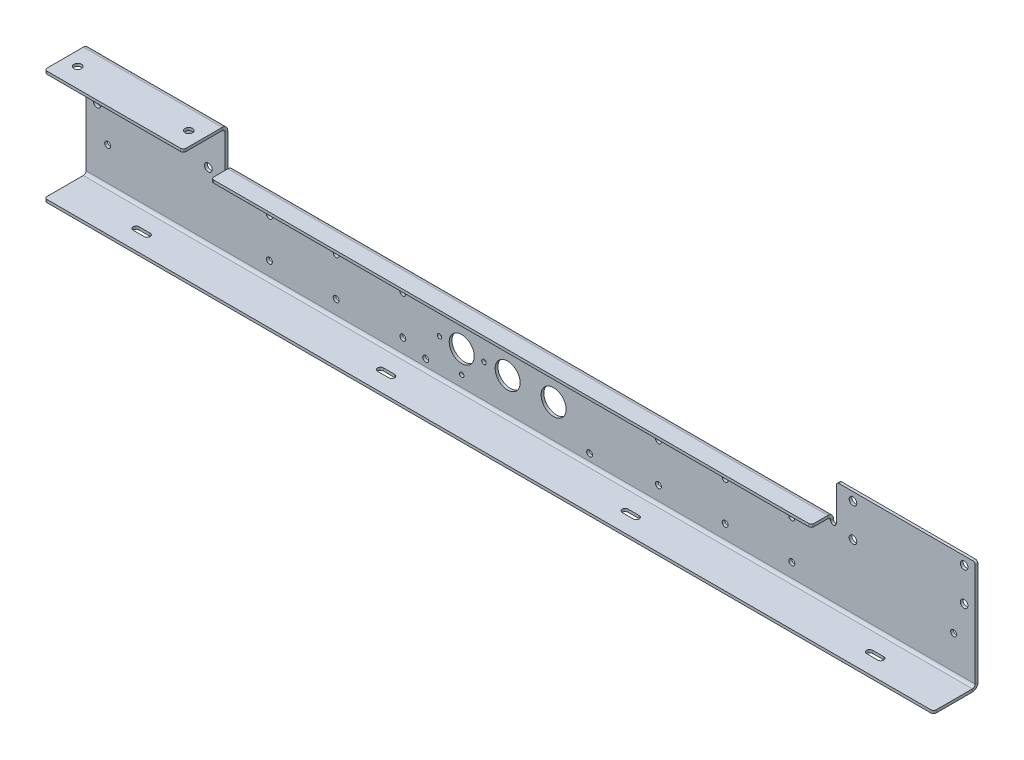
from build123d import *

# Parameters (mm, degrees)
SKETCH1_R                            = 3.37312
SKETCH1_R_2                          = 14.2875
SKETCH1_R_3                          = 3.3734375
SKETCH1_R_4                          = 2.5527
BASE_FLANGE1_DEPTH                   = 3.175
EDGE_FLANGE1_DEPTH                   = 1016
EDGE_FLANGE2_DEPTH                   = 685.8
EDGE_FLANGE3_STRIP_W                 = 19.05
EDGE_FLANGE3_STRIP_H                 = 3.175
EDGE_FLANGE3_STRIP_CUT_DEPTH         = 158.75
EDGE_FLANGE3_DEPTH                   = 158.75
FILLET1_R                            = 3.175
F_17_64_0_26563_DIAMETER_HOLE1_D     = 6.747002
F_11_32_0_34375_DIAMETER_HOLE1_D     = 8.73125
F_11_32_0_34375_DIAMETER_HOLE2_D     = 8.73125
F_11_32_0_34375_DIAMETER_HOLE2_DEPTH = 3.175
CUT_EXTRUDE2_DEPTH                   = 552.199750341


# Sheet-metal steps are written as plain solids
with BuildPart() as part:
    # Sketch1 → Base-Flange1 (new body)
    with BuildSketch(Plane.XY):
        with BuildLine():
            Line((-481.7491, 38.1), (-481.7491, 82.55))
            Line((-481.7491, 82.55), (-322.9991, 82.55))
            Line((-322.9991, 82.55), (-322.9991, 41.275))
            ThreePointArc((-322.9991, 41.275), (-322.06916403, 39.02993597), (-319.8241, 38.1))
            Line((-319.8241, 38.1), (-319.7987, 38.1))
            ThreePointArc((-319.7987, 38.1), (-317.571596482, 39.022496482), (-316.6491, 41.2496))
            Line((-316.6491, 41.2496), (-316.6491, 41.5036))
            Line((-316.6491, 41.5036), (369.1509, 41.5036))
            Line((369.1509, 41.5036), (369.1509, 41.2496))
            ThreePointArc((369.1509, 41.2496), (370.073396482, 39.022496482), (372.3005, 38.1))
            Line((372.3005, 38.1), (372.3259, 38.1))
            ThreePointArc((372.3259, 38.1), (374.57096403, 39.02993597), (375.5009, 41.275))
            Line((375.5009, 41.275), (375.5009, 82.55))
            Line((375.5009, 82.55), (534.2509, 82.55))
            Line((534.2509, 82.55), (534.2509, 38.1))
            Line((534.2509, 38.1), (534.2509, -38.1))
            Line((534.2509, -38.1), (-481.7491, -38.1))
            Line((-481.7491, -38.1), (-481.7491, 38.1))
        make_face()
        with Locations((-457.073, 0)):
            Circle(SKETCH1_R, mode=Mode.SUBTRACT)
        Circle(SKETCH1_R_2, mode=Mode.SUBTRACT)
        with Locations((-52.5018, 0)):
            Circle(SKETCH1_R_2, mode=Mode.SUBTRACT)
        with Locations((52.5018, 0)):
            Circle(SKETCH1_R_2, mode=Mode.SUBTRACT)
        with Locations((509.5748, 0)):
            Circle(SKETCH1_R, mode=Mode.SUBTRACT)
        with Locations((-93.6625, 30.1625)):
            Circle(SKETCH1_R_3, mode=Mode.SUBTRACT)
        with Locations((93.6625, 30.1625)):
            Circle(SKETCH1_R_3, mode=Mode.SUBTRACT)
        with Locations((93.6625, -30.1625)):
            Circle(SKETCH1_R_3, mode=Mode.SUBTRACT)
        with Locations((-93.6625, -30.1625)):
            Circle(SKETCH1_R_3, mode=Mode.SUBTRACT)
        with Locations((-27.1018, 0)):
            Circle(SKETCH1_R_4, mode=Mode.SUBTRACT)
        with Locations((-52.5018, 25.4)):
            Circle(SKETCH1_R_4, mode=Mode.SUBTRACT)
        with Locations((-52.5018, -25.4)):
            Circle(SKETCH1_R_4, mode=Mode.SUBTRACT)
        with Locations((-77.9018, 0)):
            Circle(SKETCH1_R_4, mode=Mode.SUBTRACT)
    extrude(amount=-BASE_FLANGE1_DEPTH)

    # Edge-Flange1 section (across the edge) → Edge-Flange1 (add)
    with BuildSketch(Plane(origin=(-481.7491, -41.275, 0), x_dir=(0, 1, 0), z_dir=(1, 0, 0))):
        with BuildLine():
            Line((-3.175, 3.175), (-3.175, 47.625))
            Line((-3.175, 47.625), (0, 47.625))
            Line((0, 47.625), (0, 3.175))
            ThreePointArc((0, 3.175), (0.92993597, 0.92993597), (3.175, 0))
            Line((3.175, 0), (3.175, -3.175))
            ThreePointArc((3.175, -3.175), (-1.315128061, -1.315128061), (-3.175, 3.175))
        make_face()
    extrude(amount=EDGE_FLANGE1_DEPTH)

    # Edge-Flange2 section (across the edge) → Edge-Flange2 (add)
    with BuildSketch(Plane(origin=(369.1509, 44.6786, 0), x_dir=(0, -1, 0), z_dir=(-1, 0, 0))):
        with BuildLine():
            Line((-3.175, 3.175), (-3.175, 22.225))
            Line((-3.175, 22.225), (0, 22.225))
            Line((0, 22.225), (0, 3.175))
            ThreePointArc((0, 3.175), (0.92993597, 0.92993597), (3.175, 0))
            Line((3.175, 0), (3.175, -3.175))
            ThreePointArc((3.175, -3.175), (-1.315128061, -1.315128061), (-3.175, 3.175))
        make_face()
    extrude(amount=EDGE_FLANGE2_DEPTH)

    # Edge-Flange3 strip (across the edge) → Edge-Flange3 strip cut (cut)
    with BuildSketch(Plane(origin=(-322.9991, 82.55, 0), x_dir=(0, -1, 0), z_dir=(-1, 0, 0))):
        with Locations((-6.35, -1.5875)):
            Rectangle(EDGE_FLANGE3_STRIP_W, EDGE_FLANGE3_STRIP_H)
    extrude(amount=EDGE_FLANGE3_STRIP_CUT_DEPTH, mode=Mode.SUBTRACT)

    # Edge-Flange3 section (across the edge) → Edge-Flange3 (add)
    with BuildSketch(Plane(origin=(-322.9991, 82.55, 0), x_dir=(0, -1, 0), z_dir=(-1, 0, 0))):
        with BuildLine():
            Line((-3.175, 3.175), (-3.175, 47.625))
            Line((-3.175, 47.625), (0, 47.625))
            Line((0, 47.625), (0, 3.175))
            ThreePointArc((0, 3.175), (0.92993597, 0.92993597), (3.175, 0))
            Line((3.175, 0), (3.175, -3.175))
            ThreePointArc((3.175, -3.175), (-1.315128061, -1.315128061), (-3.175, 3.175))
        make_face()
    extrude(amount=EDGE_FLANGE3_DEPTH)

    # Fillet1
    fillet1_edges = [part.edges().sort_by_distance(p)[0] for p in [
        (-481.7491, -42.8625, 47.625),
        (534.2509, -42.8625, 47.625),
        (369.1509, 46.2661, 22.225),
        (-316.6491, 46.2661, 22.225),
        (-322.9991, 84.1375, 47.625),
        (-481.7491, 84.1375, 47.625),
        (375.5009, 82.55, -1.5875),
        (534.2509, 82.55, -1.5875),
    ]]
    fillet(fillet1_edges, radius=FILLET1_R)

    # 17/64 (0.26563) Diameter Hole1 (through all)
    with Locations(Plane(origin=(0, 0, -3.175), x_dir=(-1, 0, 0), z_dir=(0, 0, -1))):
        with Locations((-324.7009, -22.225), (-324.7009, 22.225), (-172.3009, 22.225), (-172.3009, -22.225), (119.7991, 22.225), (272.1991, 22.225), (272.1991, -22.225), (119.7991, -22.225), (-248.5009, 22.225), (-248.5009, -22.225), (195.9991, 22.225), (195.9991, -22.225)):
            Hole(F_17_64_0_26563_DIAMETER_HOLE1_D / 2)

    # 11/32 (0.34375) Diameter Hole1 (through all)
    with Locations(Plane(origin=(0, 0, -3.175), x_dir=(-1, 0, 0), z_dir=(0, 0, -1))):
        with Locations((-394.5509, 73.025), (-394.5509, 34.925), (-521.5509, 34.925), (-521.5509, 73.025), (342.0491, 34.925), (469.0491, 34.925)):
            Hole(F_11_32_0_34375_DIAMETER_HOLE1_D / 2)

    # 11/32 (0.34375) Diameter Hole2
    with Locations(Plane(origin=(0, 85.725, 0), x_dir=(1, 0, 0), z_dir=(0, 1, 0))):
        with Locations((-465.8741, -25.4), (-338.8741, -25.4)):
            Hole(F_11_32_0_34375_DIAMETER_HOLE2_D / 2, depth=F_11_32_0_34375_DIAMETER_HOLE2_DEPTH)

    # Sketch34 → Cut-Extrude2 (cut, through all)
    with BuildSketch(Plane(origin=(0, -41.275, 0), x_dir=(1, 0, 0), z_dir=(0, 1, 0))):
        with BuildLine():
            Line((-399.1991, -22.0265625), (-386.4991, -22.0265625))
            ThreePointArc((-386.4991, -22.0265625), (-383.1256625, -25.4), (-386.4991, -28.7734375))
            Line((-386.4991, -28.7734375), (-399.1991, -28.7734375))
            ThreePointArc((-399.1991, -28.7734375), (-402.5725375, -25.4), (-399.1991, -22.0265625))
        make_face()
        with BuildLine():
            Line((-107.0991, -28.7734375), (-119.7991, -28.7734375))
            ThreePointArc((-119.7991, -28.7734375), (-123.1725375, -25.4), (-119.7991, -22.0265625))
            Line((-119.7991, -22.0265625), (-107.0991, -22.0265625))
            ThreePointArc((-107.0991, -22.0265625), (-103.7256625, -25.4), (-107.0991, -28.7734375))
        make_face()
        with BuildLine():
            Line((159.6009, -22.0265625), (172.3009, -22.0265625))
            ThreePointArc((172.3009, -22.0265625), (175.6743375, -25.4), (172.3009, -28.7734375))
            Line((172.3009, -28.7734375), (159.6009, -28.7734375))
            ThreePointArc((159.6009, -28.7734375), (156.2274625, -25.4), (159.6009, -22.0265625))
        make_face()
        with BuildLine():
            Line((439.0009, -22.0265625), (451.7009, -22.0265625))
            ThreePointArc((451.7009, -22.0265625), (455.0743375, -25.4), (451.7009, -28.7734375))
            Line((451.7009, -28.7734375), (439.0009, -28.7734375))
            ThreePointArc((439.0009, -28.7734375), (435.6274625, -25.4), (439.0009, -22.0265625))
        make_face()
    extrude(amount=-CUT_EXTRUDE2_DEPTH, mode=Mode.SUBTRACT)


solid = part.part
